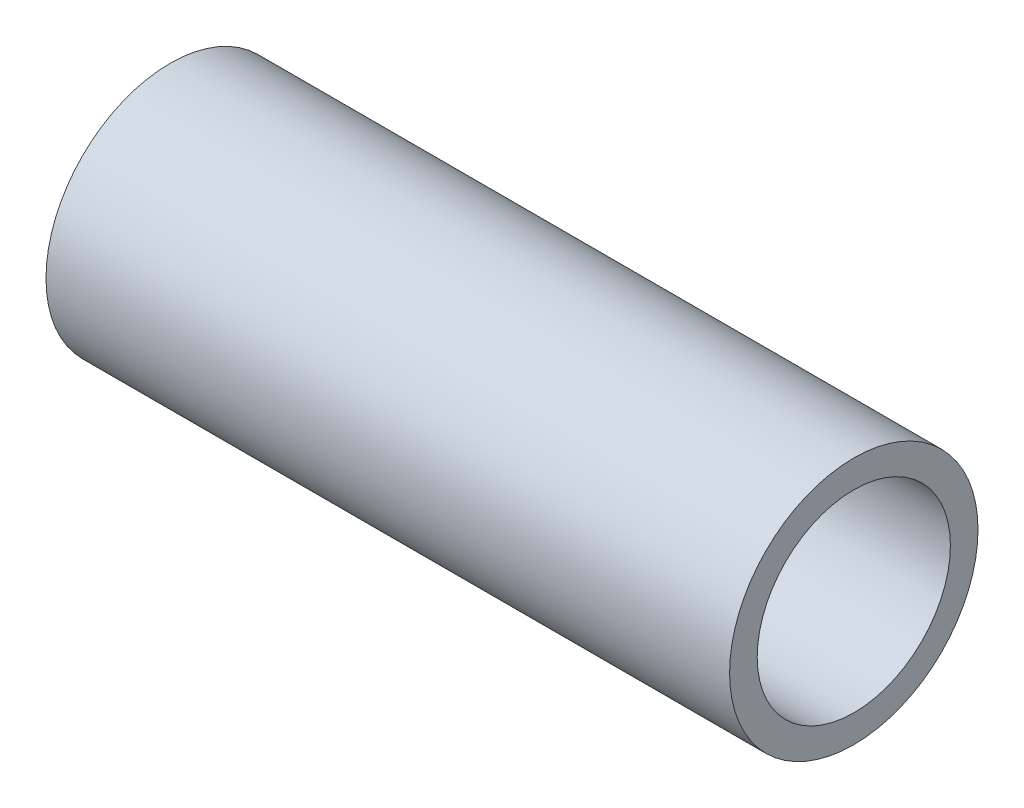
from build123d import *

# Parameters (mm, degrees)
THREAD1_PITCH = 1.5


with BuildPart() as part:
    # Sketch1 → Revolve1 (revolve)
    with BuildSketch(Plane.XY, mode=Mode.PRIVATE) as revolve1_sk:
        Polygon((0, 6), (0, 14.2875), (78.6384, 14.2875), (78.6384, 11.1125), (53.2384, 11.1125), (53.2384, 12.7), (15.875, 12.7), (15.875, 6), align=None)
    revolve(revolve1_sk.sketch.rotate(Axis((0, 0, 0), (1, 0, 0)), 90), axis=Axis((0, 0, 0), (1, 0, 0)))

    # Thread1: the profile of Thread Profile1 profile screwed along a right-hand helix of 12.7 turns, 8 arcs to a turn; built about Z, then put on its axis
    thread1_z = Axis((0, 0, 0), (0, 0, 1))
    thread1_corners = [(5.9997, 0, -0.000173205), (6.811898812, 0, 0.468749998), (6.811898812, 0, 0.656249998), (5.9997, 0, 1.125173201)]
    with BuildLine(mode=Mode.PRIVATE) as thread1_profile:
        Line(thread1_corners[0], thread1_corners[1])
        Line(thread1_corners[1], thread1_corners[2])
        Line(thread1_corners[2], thread1_corners[3])
        Line(thread1_corners[3], thread1_corners[0])
    thread1_cap = Face(thread1_profile.wire())
    thread1_turn_angles = [0, 22.5, 45, 67.5, 90, 112.5, 135, 157.5, 180, 202.5, 225, 247.5, 270, 292.5, 315, 337.5, 360]
    thread1_turn_weights = [1, 0.9238795325112867, 1, 0.9238795325112867, 1, 0.9238795325112867, 1, 0.9238795325112867, 1, 0.9238795325112867, 1, 0.9238795325112867, 1, 0.9238795325112867, 1, 0.9238795325112867, 1]
    thread1_turn_rails = [Edge.make_bspline([Vector(p[0], p[1], 0).rotate(thread1_z, thread1_turn_angles[k]) / thread1_turn_weights[k] + Vector(0, 0, p[2] + THREAD1_PITCH * thread1_turn_angles[k] / 360) for k in range(17)], [0, 0, 0, 1, 1, 2, 2, 3, 3, 4, 4, 5, 5, 6, 6, 7, 7, 8, 8, 8], 2, thread1_turn_weights) for p in thread1_corners]
    thread1_turn_sides = [Face.make_surface_from_curves(thread1_turn_rails[p[0]], thread1_turn_rails[p[1]]) for p in [(0, 1), (1, 2), (2, 3), (3, 0)]]
    thread1_last_angles = [4320, 4342.5, 4365, 4387.5, 4410, 4432.5, 4455, 4477.5, 4500, 4522.5, 4545, 4558.5, 4572]
    thread1_last_weights = [1, 0.9238795325112867, 1, 0.9238795325112867, 1, 0.9238795325112867, 1, 0.9238795325112867, 1, 0.9238795325112867, 1, 0.9723699203976784, 1]
    thread1_last_rails = [Edge.make_bspline([Vector(p[0], p[1], 0).rotate(thread1_z, thread1_last_angles[k]) / thread1_last_weights[k] + Vector(0, 0, p[2] + THREAD1_PITCH * thread1_last_angles[k] / 360) for k in range(13)], [0, 0, 0, 1, 1, 2, 2, 3, 3, 4, 4, 5, 5, 6, 6, 6], 2, thread1_last_weights) for p in thread1_corners]
    thread1_last_sides = [Face.make_surface_from_curves(thread1_last_rails[p[0]], thread1_last_rails[p[1]]) for p in [(0, 1), (1, 2), (2, 3), (3, 0)]]
    thread1 = Plane(origin=(0, 0, 0), x_dir=(0, 0, -1), z_dir=(1, 0, 0)) * Solid(Shell([*[p.moved(Location((0, 0, THREAD1_PITCH * i))) for i in range(12) for p in thread1_turn_sides], *thread1_last_sides, thread1_cap, thread1_cap.rotate(thread1_z, 4572).moved(Location((0, 0, THREAD1_PITCH * 4572 / 360)))]))
    add(thread1, mode=Mode.SUBTRACT)


solid = part.part
